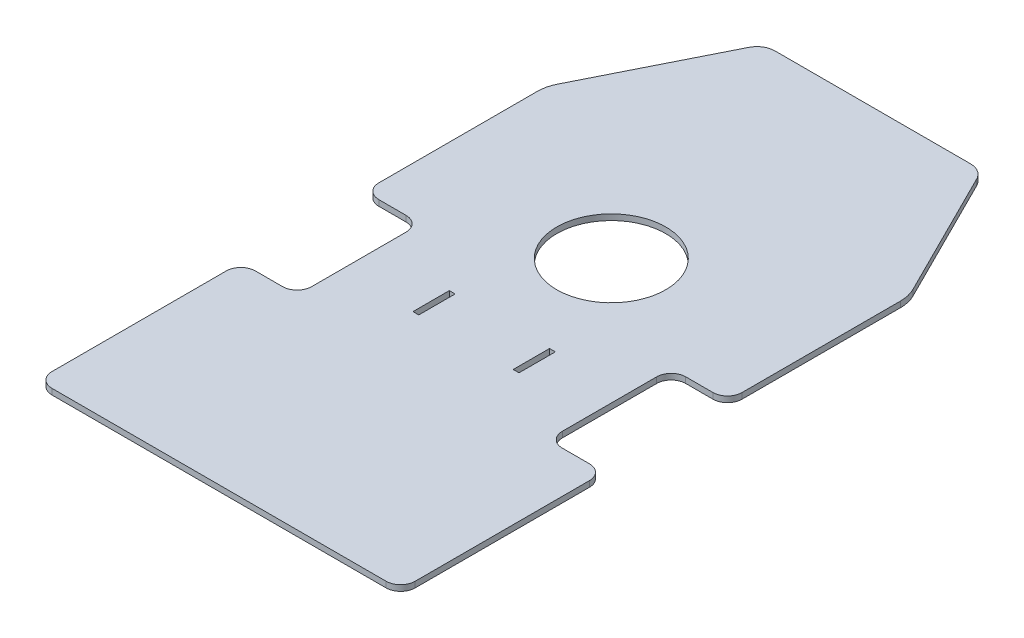
from build123d import *

# Parameters (mm, degrees)
RESSALTO_EXTRUS_O1_DEPTH = 0.8
FILETE6_R                = 2
CHANFRO3_SIZE            = 10
CHANFRO3_SIZE2           = 20
CHANFRO4_SIZE            = 20
CHANFRO4_SIZE2           = 10
FILETE7_R                = 2.5
ESBO_O7_R                = 7.5
CORTE_EXTRUS_O1_DEPTH    = 0.8
CAVIDADE1_START          = -7.3
CAVIDADE1_OUTLINE_W      = 0.8
CAVIDADE1_OUTLINE_H      = 5
CAVIDADE1_DEPTH          = 0.8
CAVIDADE1_START_2        = 6.5
CAVIDADE1_2_OUTLINE_W    = 0.8
CAVIDADE1_2_OUTLINE_H    = 5
CAVIDADE1_2_DEPTH        = 0.8
FILETE8_R                = 5


# Read off the part's stored shape, not the designer's step: Cavidade1
with BuildPart() as part:
    # Esboço1 → Ressalto-extrusão1 (new body)
    with BuildSketch(Plane(origin=(0, 0, 0), x_dir=(1, 0, 0), z_dir=(0, 1, 0))):
        Polygon((-17.25, 45), (-25, 45), (-25, 90), (0, 90), (0, 0), (-25, 0), (-25, 28), (-17.25, 28), align=None)
    ressalto_extrus_o1 = extrude(amount=RESSALTO_EXTRUS_O1_DEPTH)

    # Espelhar8: Ressalto-extrusão1 across plane
    add(ressalto_extrus_o1.mirror(Plane(origin=(0, 0, 0), x_dir=(0, 0, 1), z_dir=(1, 0, 0))))

    # Filete6
    filete6_edges = [part.edges().sort_by_distance(p)[0] for p in [
        (-25, 0.4, -45),
        (-17.25, 0.4, -45),
        (-17.25, 0.4, -28),
        (-25, 0.4, -28),
        (-25, 0.4, 0),
        (25, 0.4, 0),
        (25, 0.4, -28),
        (17.25, 0.4, -28),
        (17.25, 0.4, -45),
        (25, 0.4, -45),
    ]]
    fillet(filete6_edges, radius=FILETE6_R)

    # Chanfro3
    chanfro3_edges = [part.edges().sort_by_distance(p)[0] for p in [
        (-25, 0.4, -90),
    ]]
    chanfro3_side = [part.faces().sort_by_distance(p)[0] for p in [
        (0, 0.4, -90),
    ]]
    chamfer(chanfro3_edges, length=CHANFRO3_SIZE, length2=CHANFRO3_SIZE2, reference=chanfro3_side[0])

    # Chanfro4
    chanfro4_edges = [part.edges().sort_by_distance(p)[0] for p in [
        (25, 0.4, -90),
    ]]
    chanfro4_side = [part.faces().sort_by_distance(p)[0] for p in [
        (25, 0.4, -68.5),
    ]]
    chamfer(chanfro4_edges, length=CHANFRO4_SIZE, length2=CHANFRO4_SIZE2, reference=chanfro4_side[0])

    # Filete7
    filete7_edges = [part.edges().sort_by_distance(p)[0] for p in [
        (-15, 0.4, -90),
        (15, 0.4, -90),
    ]]
    fillet(filete7_edges, radius=FILETE7_R)

    # Esboço7 → Corte-extrusão1 (cut)
    with BuildSketch(Plane(origin=(0, 0.8, 0), x_dir=(1, 0, 0), z_dir=(0, 1, 0))):
        with Locations(Location((0, 54, 0), (0, 0, 270))):
            Circle(ESBO_O7_R)
    extrude(amount=-CORTE_EXTRUS_O1_DEPTH, mode=Mode.SUBTRACT)

    # Cavidade1 outline → Cavidade1 (cut)
    with BuildSketch(Plane.YZ.offset(CAVIDADE1_START)):
        with Locations((0.4, -36.5)):
            Rectangle(CAVIDADE1_OUTLINE_W, CAVIDADE1_OUTLINE_H)
    extrude(amount=CAVIDADE1_DEPTH, mode=Mode.SUBTRACT)

    # Cavidade1 2 outline → Cavidade1 2 (cut)
    with BuildSketch(Plane.YZ.offset(CAVIDADE1_START_2)):
        with Locations((0.4, -36.5)):
            Rectangle(CAVIDADE1_2_OUTLINE_W, CAVIDADE1_2_OUTLINE_H)
    extrude(amount=CAVIDADE1_2_DEPTH, mode=Mode.SUBTRACT)

    # Filete8
    filete8_edges = [part.edges().sort_by_distance(p)[0] for p in [
        (-25, 0.4, -70),
        (25, 0.4, -70),
    ]]
    fillet(filete8_edges, radius=FILETE8_R)


solid = part.part
